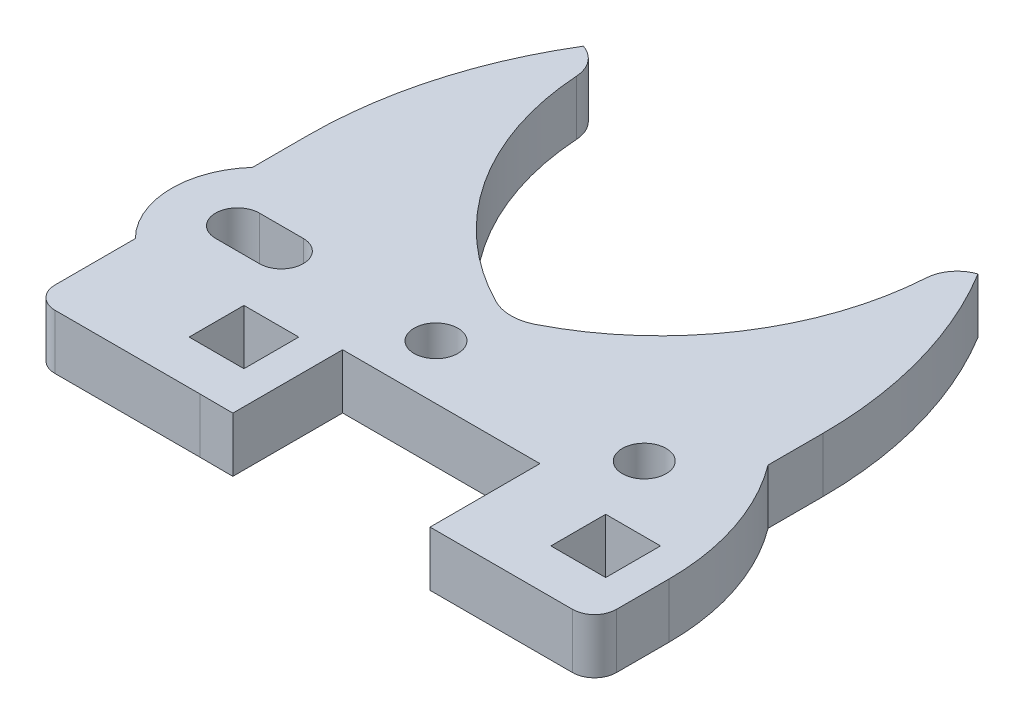
from build123d import *

# Parameters (mm, degrees)
SKETCH1_W           = 5.001317171
SKETCH1_H           = 5
SKETCH1_R           = 2
SKETCH1_W_2         = 5
BOSS_EXTRUDE1_DEPTH = 5
FILLET1_R           = 4
FILLET2_R           = 3
FILLET3_R           = 3


with BuildPart() as part:
    # Sketch1 → Boss-Extrude1 (new body)
    with BuildSketch(Plane(origin=(0, 0, 0), x_dir=(1, 0, 0), z_dir=(0, 1, 0))):
        with BuildLine():
            Line((18, 33.943656531), (16, 33.943656531))
            Line((16, 33.943656531), (16, 32.943656531))
            ThreePointArc((16, 32.943656531), (11.633307653, 18.521451429), (0, 8.943656531))
            ThreePointArc((0, 8.943656531), (-11.633307653, 18.521451429), (-16, 32.943656531))
            Line((-16, 32.943656531), (-16, 33.943656531))
            Line((-16, 33.943656531), (-18, 33.943656531))
            ThreePointArc((-18, 33.943656531), (-22.110006153, 24.491379681), (-23.514801823, 14.280393571))
            Line((-23.514801823, 14.280393571), (-23.514801823, 9.280393571))
            ThreePointArc((-23.514801823, 9.280393571), (-25.552366673, 3.738409631), (-23.233209016, -1.691762031))
            Line((-23.233209016, -1.691762031), (-23.233209016, -9.018158061))
            ThreePointArc((-23.233209016, -9.018158061), (-22.647422579, -10.432371623), (-21.233209016, -11.018158061))
            Line((-21.233209016, -11.018158061), (-13, -11.018158061))
            Line((-13, -11.018158061), (-7.998682829, -11.018158061))
            Line((-7.998682829, -11.018158061), (-4.998682829, -11.0314348))
            Line((-4.998682829, -11.0314348), (-4.998682829, -1.018158061))
            Line((-4.998682829, -1.018158061), (-2.998682829, -1.018158061))
            Line((-2.998682829, -1.018158061), (13, -1.018158061))
            Line((13, -1.018158061), (13, -11.04028596))
            Line((13, -11.04028596), (26, -11.04028596))
            ThreePointArc((26, -11.04028596), (27.414213562, -10.454499522), (28, -9.04028596))
            Line((28, -9.04028596), (28, -4.239034491))
            ThreePointArc((28, -4.239034491), (26.849436145, 2.882972561), (23.514801823, 9.280393571))
            Line((23.514801823, 9.280393571), (23.514801823, 14.280393571))
            ThreePointArc((23.514801823, 14.280393571), (22.110006153, 24.491379681), (18, 33.943656531))
        make_face()
        with Locations((-10.499341414, -4.518158061)):
            Rectangle(SKETCH1_W, SKETCH1_H, mode=Mode.SUBTRACT)
        with BuildLine():
            ThreePointArc((-19.589388553, 1.981841939), (-21.589388553, 3.981841939), (-19.589388553, 5.981841939))
            Line((-19.589388553, 5.981841939), (-15.589388553, 5.981841939))
            ThreePointArc((-15.589388553, 5.981841939), (-13.589388553, 3.981841939), (-15.589388553, 1.981841939))
            Line((-15.589388553, 1.981841939), (-19.589388553, 1.981841939))
        make_face(mode=Mode.SUBTRACT)
        with Locations(Location((-1.445, 3.943656531, 0), (0, 0, 270))):
            Circle(SKETCH1_R, mode=Mode.SUBTRACT)
        with Locations((22.5, -4.518158061)):
            Rectangle(SKETCH1_W_2, SKETCH1_H, mode=Mode.SUBTRACT)
        with Locations(Location((17.555, 3.943656531, 0), (0, 0, 270))):
            Circle(SKETCH1_R, mode=Mode.SUBTRACT)
    extrude(amount=BOSS_EXTRUDE1_DEPTH)

    # Fillet1
    fillet1_edges = [part.edges().sort_by_distance(p)[0] for p in [
        (0, 2.5, -8.943656531),
    ]]
    fillet(fillet1_edges, radius=FILLET1_R)

    # Fillet2
    # the kernel refuses this fillet: 3 mm, written as the material it takes off along each edge
    with BuildSketch(Plane(origin=(16, -6.644712065, -33.943656531), x_dir=(-0.019894609369720543, 0, 0.999802082673379), z_dir=(0, 1, 0))) as fillet2_piece_1:
        with BuildLine():
            CenterArc((2.789518237, 2.997110716), FILLET2_R, 199.420718405, 68.064461233)
            Line((-0.039789219, 1.999604165), (-0.322719964, 1.89985351))
            ThreePointArc((-0.322719964, 1.89985351), (-0.319835234, 0.9938337), (-0.299940625, -0.005968383))
            Line((-0.299940625, -0.005968383), (0.005968383, -0.299940625))
            ThreePointArc((0.005968383, -0.299940625), (1.005770465, -0.280046015), (2.644721485, -0.299711072))
            Line((2.644721485, -0.299711072), (2.657884826, 0))
        make_face()
    extrude(amount=18.289424129, mode=Mode.SUBTRACT)

    # Fillet3
    # the kernel refuses this fillet: 3 mm, written as the material it takes off along each edge
    with BuildSketch(Plane(origin=(-16, -6.644712065, -33.943656531), x_dir=(-1, 0, 0), z_dir=(0, 1, 0))) as fillet3_piece_1:
        with BuildLine():
            CenterArc((2.94102116, 2.84859249), FILLET3_R, 183.654772721, 68.064461233)
            Line((-0.05287758, 2.657358784), (-0.352267454, 2.638235414))
            ThreePointArc((-0.352267454, 2.638235414), (-0.3, 1), (-0.3, 0))
            Line((-0.3, 0), (0, -0.3))
            ThreePointArc((0, -0.3), (1, -0.3), (1.905897884, -0.284859249))
            Line((1.905897884, -0.284859249), (2, 0))
        make_face()
    extrude(amount=18.289424129, mode=Mode.SUBTRACT)


solid = part.part
